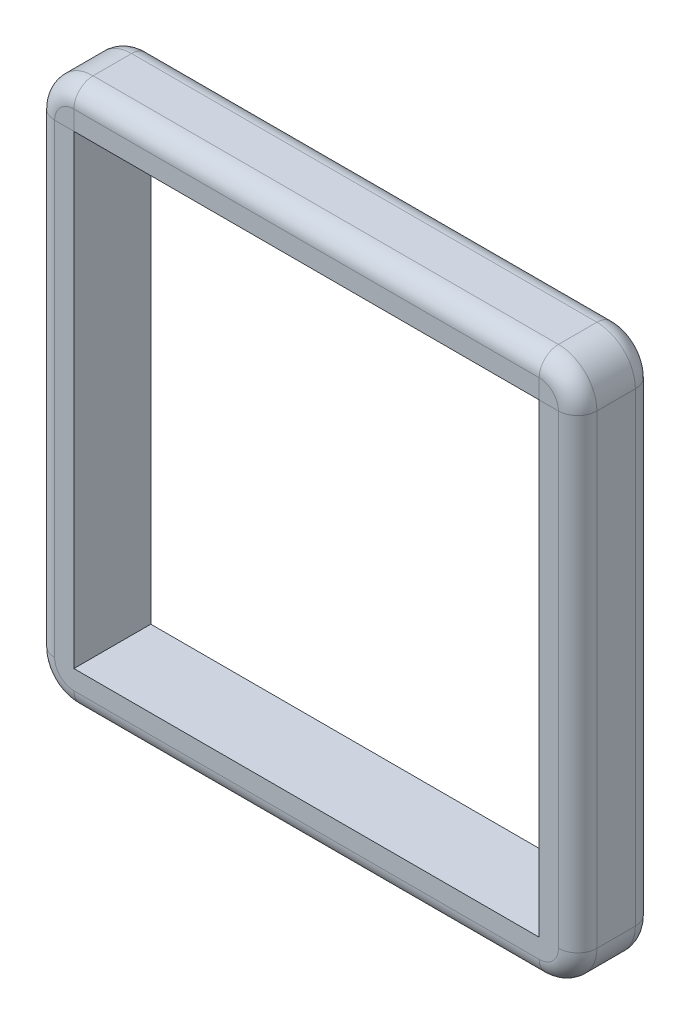
from build123d import *

# Parameters (mm, degrees)
BOSS_EXTRUDE1_DEPTH = 768.35
BOSS_EXTRUDE2_DEPTH = 768.35
BOSS_EXTRUDE3_DEPTH = 768.35
BOSS_EXTRUDE4_DEPTH = 768.35
REVOLVE2_ANGLE      = 90
REVOLVE3_ANGLE      = 90
REVOLVE8_ANGLE      = 90
REVOLVE10_ANGLE     = 90


# Read off the part's stored shape, not the designer's step: Revolve2, Revolve3
with BuildPart() as part:
    # Sketch2 → Boss-Extrude1 (new body)
    with BuildSketch(Plane(origin=(0, 0, 0), x_dir=(1, 0, 0), z_dir=(0, 1, 0))):
        with BuildLine():
            Line((31.75, 31.75), (0, 31.75))
            ThreePointArc((0, 31.75), (-22.450640303, 22.450640303), (-31.75, 0))
            Line((-31.75, 0), (-31.75, -63.5))
            ThreePointArc((-31.75, -63.5), (-22.450640303, -85.950640303), (0, -95.25))
            Line((0, -95.25), (31.75, -95.25))
            Line((31.75, -95.25), (31.75, 31.75))
        make_face()
    extrude(amount=BOSS_EXTRUDE1_DEPTH)



with BuildPart() as body_2:
    # Sketch7 → Boss-Extrude2 (new body)
    with BuildSketch(Plane(origin=(31.75, 0, 0), x_dir=(0, 0, -1), z_dir=(1, 0, 0))):
        with BuildLine():
            Line((31.75, 768.35), (31.75, 800.1))
            ThreePointArc((31.75, 800.1), (22.450640303, 822.550640303), (0, 831.85))
            Line((0, 831.85), (-63.5, 831.85))
            ThreePointArc((-63.5, 831.85), (-85.950640303, 822.550640303), (-95.25, 800.1))
            Line((-95.25, 800.1), (-95.25, 768.35))
            Line((-95.25, 768.35), (31.75, 768.35))
        make_face()
    extrude(amount=BOSS_EXTRUDE2_DEPTH)


with BuildPart() as body_3:
    # Sketch9 → Boss-Extrude3 (new body)
    with BuildSketch(Plane(origin=(0, 768.35, 0), x_dir=(-1, 0, 0), z_dir=(0, -1, 0))):
        with BuildLine():
            Line((-800.1, -95.25), (-800.1, 31.75))
            Line((-800.1, 31.75), (-831.85, 31.75))
            ThreePointArc((-831.85, 31.75), (-854.300640303, 22.450640303), (-863.6, 0))
            Line((-863.6, 0), (-863.6, -63.5))
            ThreePointArc((-863.6, -63.5), (-854.300640303, -85.950640303), (-831.85, -95.25))
            Line((-831.85, -95.25), (-800.1, -95.25))
        make_face()
    extrude(amount=BOSS_EXTRUDE3_DEPTH)


with BuildPart() as body_4:
    # Sketch10 → Boss-Extrude4 (new body)
    with BuildSketch(Plane.ZY.offset(-800.1)):
        with BuildLine():
            Line((95.25, 0), (95.25, -31.75))
            ThreePointArc((95.25, -31.75), (85.950640303, -54.200640303), (63.5, -63.5))
            Line((63.5, -63.5), (0, -63.5))
            ThreePointArc((0, -63.5), (-22.450640303, -54.200640303), (-31.75, -31.75))
            Line((-31.75, -31.75), (-31.75, 0))
            Line((-31.75, 0), (95.25, 0))
        make_face()
    extrude(amount=BOSS_EXTRUDE4_DEPTH)


with BuildPart() as part_1:
    add(part.part)

    add(body_4.part)  # Revolve2 merges body 4
    # Revolve2 outline → Revolve2 (revolve)
    with BuildSketch(Plane(origin=(31.75, 0, 0), x_dir=(-1, 0, 0), z_dir=(0, 1, 0))):
        with BuildLine():
            Line((31.75, 95.25), (0, 95.25))
            Line((0, 95.25), (0, -31.75))
            Line((0, -31.75), (31.75, -31.75))
            ThreePointArc((31.75, -31.75), (54.200640303, -22.450640303), (63.5, 0))
            Line((63.5, 0), (63.5, 63.5))
            ThreePointArc((63.5, 63.5), (54.200640303, 85.950640303), (31.75, 95.25))
        make_face()
    revolve(axis=Axis((31.75, 0, 0), (0, 0, 1)), revolution_arc=REVOLVE2_ANGLE)


    add(body_3.part)  # Revolve3 merges body 3
    # Revolve3 outline → Revolve3 (revolve)
    with BuildSketch(Plane(origin=(800.1, 0, 0), x_dir=(0, -1, 0), z_dir=(-1, 0, 0))):
        with BuildLine():
            Line((0, 95.25), (0, -31.75))
            Line((0, -31.75), (31.75, -31.75))
            ThreePointArc((31.75, -31.75), (54.200640303, -22.450640303), (63.5, 0))
            Line((63.5, 0), (63.5, 63.5))
            ThreePointArc((63.5, 63.5), (54.200640303, 85.950640303), (31.75, 95.25))
            Line((31.75, 95.25), (0, 95.25))
        make_face()
    revolve(axis=Axis((800.1, 0, 0), (0, 0, 1)), revolution_arc=REVOLVE3_ANGLE)


with BuildPart() as body_3_2:
    # Sketch7<3> → Revolve8 (revolve)
    with BuildSketch(Plane(origin=(31.75, 0, 0), x_dir=(0, 0, -1), z_dir=(1, 0, 0))):
        with BuildLine():
            Line((31.75, 768.35), (31.75, 800.1))
            ThreePointArc((31.75, 800.1), (22.450640303, 822.550640303), (0, 831.85))
            Line((0, 831.85), (-63.5, 831.85))
            ThreePointArc((-63.5, 831.85), (-85.950640303, 822.550640303), (-95.25, 800.1))
            Line((-95.25, 800.1), (-95.25, 768.35))
            Line((-95.25, 768.35), (31.75, 768.35))
        make_face()
    revolve(axis=Axis((31.75, 768.35, 95.25), (0, 0, 1)), revolution_arc=REVOLVE8_ANGLE)


with BuildPart() as body_4_2:
    # Sketch9<2> → Revolve10 (revolve)
    with BuildSketch(Plane(origin=(0, 768.35, 0), x_dir=(-1, 0, 0), z_dir=(0, -1, 0))):
        with BuildLine():
            Line((-800.1, -95.25), (-800.1, 31.75))
            Line((-800.1, 31.75), (-831.85, 31.75))
            ThreePointArc((-831.85, 31.75), (-854.300640303, 22.450640303), (-863.6, 0))
            Line((-863.6, 0), (-863.6, -63.5))
            ThreePointArc((-863.6, -63.5), (-854.300640303, -85.950640303), (-831.85, -95.25))
            Line((-831.85, -95.25), (-800.1, -95.25))
        make_face()
    revolve(axis=Axis((800.1, 768.35, 95.25), (0, 0, 1)), revolution_arc=REVOLVE10_ANGLE)


solid = Compound([body_2.part, part_1.part, body_3_2.part, body_4_2.part])
